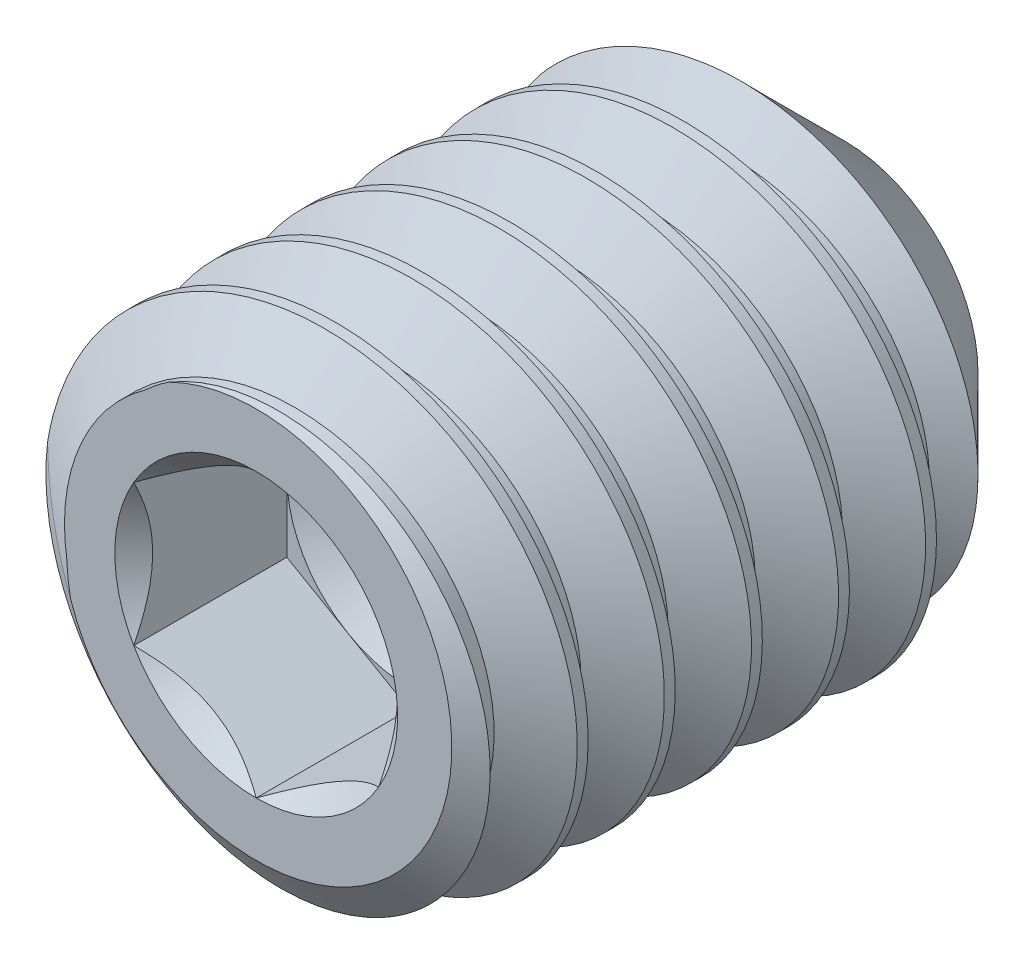
from build123d import *

# Parameters (mm, degrees)
CUT_SWEEP2_PITCH    = 1.411111111
CUT_EXTRUDE10_DEPTH = 2.48046875


with BuildPart() as part:
    # Sketch22 → Revolve1 (revolve)
    with BuildSketch(Plane(origin=(0, 0, 0), x_dir=(0, 0, -1), z_dir=(1, 0, 0)), mode=Mode.PRIVATE) as revolve1_sk:
        Polygon((-4.110188844, 0), (-4.110188844, 3.16992), (-3.555288375, 3.9624), (3.6236673, 3.9624), (5.414811156, 2.171256145), (4.110188844, 0), align=None)
    revolve(revolve1_sk.sketch.rotate(Axis((0, 0, -4.110188844), (0, 0, -1)), 180), axis=Axis((0, 0, -4.110188844), (0, 0, -1)))

    # Cut-Sweep2: the profile of Sketch28 profile screwed along a right-hand helix of 8.6932 turns, 8 arcs to a turn; built about Z, then put on its axis
    cut_sweep2_z = Axis((0, 0, 0), (0, 0, 1))
    cut_sweep2_corners = [(0, 3.9627, 0.000173205), (0, 3.9627, -1.234895427), (0, 3.106959351, -0.740833333), (0, 3.106959351, -0.493888889)]
    with BuildLine(mode=Mode.PRIVATE) as cut_sweep2_profile:
        Line(cut_sweep2_corners[0], cut_sweep2_corners[1])
        Line(cut_sweep2_corners[1], cut_sweep2_corners[2])
        Line(cut_sweep2_corners[2], cut_sweep2_corners[3])
        Line(cut_sweep2_corners[3], cut_sweep2_corners[0])
    cut_sweep2_cap = Face(cut_sweep2_profile.wire())
    cut_sweep2_turn_angles = [0, 22.5, 45, 67.5, 90, 112.5, 135, 157.5, 180, 202.5, 225, 247.5, 270, 292.5, 315, 337.5, 360]
    cut_sweep2_turn_weights = [1, 0.9238795325112867, 1, 0.9238795325112867, 1, 0.9238795325112867, 1, 0.9238795325112867, 1, 0.9238795325112867, 1, 0.9238795325112867, 1, 0.9238795325112867, 1, 0.9238795325112867, 1]
    cut_sweep2_turn_rails = [Edge.make_bspline([Vector(p[0], p[1], 0).rotate(cut_sweep2_z, cut_sweep2_turn_angles[k]) / cut_sweep2_turn_weights[k] + Vector(0, 0, p[2] + CUT_SWEEP2_PITCH * cut_sweep2_turn_angles[k] / 360) for k in range(17)], [0, 0, 0, 1, 1, 2, 2, 3, 3, 4, 4, 5, 5, 6, 6, 7, 7, 8, 8, 8], 2, cut_sweep2_turn_weights) for p in cut_sweep2_corners]
    cut_sweep2_turn_sides = [Face.make_surface_from_curves(cut_sweep2_turn_rails[p[0]], cut_sweep2_turn_rails[p[1]]) for p in [(0, 1), (1, 2), (2, 3), (3, 0)]]
    cut_sweep2_last_angles = [2880, 2902.5, 2925, 2947.5, 2970, 2992.5, 3015, 3037.5, 3060, 3082.5, 3105, 3117.276, 3129.552]
    cut_sweep2_last_weights = [1, 0.9238795325112867, 1, 0.9238795325112867, 1, 0.9238795325112867, 1, 0.9238795325112867, 1, 0.9238795325112867, 1, 0.97713472267616, 1]
    cut_sweep2_last_rails = [Edge.make_bspline([Vector(p[0], p[1], 0).rotate(cut_sweep2_z, cut_sweep2_last_angles[k]) / cut_sweep2_last_weights[k] + Vector(0, 0, p[2] + CUT_SWEEP2_PITCH * cut_sweep2_last_angles[k] / 360) for k in range(13)], [0, 0, 0, 1, 1, 2, 2, 3, 3, 4, 4, 5, 5, 6, 6, 6], 2, cut_sweep2_last_weights) for p in cut_sweep2_corners]
    cut_sweep2_last_sides = [Face.make_surface_from_curves(cut_sweep2_last_rails[p[0]], cut_sweep2_last_rails[p[1]]) for p in [(0, 1), (1, 2), (2, 3), (3, 0)]]
    cut_sweep2 = Plane(origin=(0, 0, -5.414811156), x_dir=(1, 0, 0), z_dir=(0, 0, 1)) * Solid(Shell([*[p.moved(Location((0, 0, CUT_SWEEP2_PITCH * i))) for i in range(8) for p in cut_sweep2_turn_sides], *cut_sweep2_last_sides, cut_sweep2_cap, cut_sweep2_cap.rotate(cut_sweep2_z, 3129.552).moved(Location((0, 0, CUT_SWEEP2_PITCH * 3129.552 / 360)))]))
    add(cut_sweep2, mode=Mode.SUBTRACT)

    # Sketch23 → Cut-Extrude10 (cut)
    with BuildSketch(Plane.XY.offset(4.110188844)):
        Polygon((0, 2.291358881), (-1.984375, 1.14567944), (-1.984375, -1.14567944), (0, -2.291358881), (1.984375, -1.14567944), (1.984375, 1.14567944), align=None)
    extrude(amount=-CUT_EXTRUDE10_DEPTH, mode=Mode.SUBTRACT)

    # Cut-Extrude11 cone 1 section (through the dimple's axis) → Cut-Extrude11 (revolve, cut)
    with BuildSketch(Plane(origin=(0, 0, 4.110188844), x_dir=(0, -1, 0), z_dir=(1, 0, 0))):
        Polygon((0, 0), (2.291358881, 0), (0, 2.291358881), align=None)
    revolve(axis=Axis((0, 0, 4.110188844), (0, 0, -1)), mode=Mode.SUBTRACT)

    # Cut-Extrude12 cone 1 section (through the dimple's axis) → Cut-Extrude12 (revolve, cut)
    with BuildSketch(Plane(origin=(0, 0, 1.629720094), x_dir=(0, -1, 0), z_dir=(1, 0, 0))):
        Polygon((0, 0), (1.984375, 0), (0, 1.14567944), align=None)
    revolve(axis=Axis((0, 0, 1.629720094), (0, 0, -1)), mode=Mode.SUBTRACT)


solid = part.part
